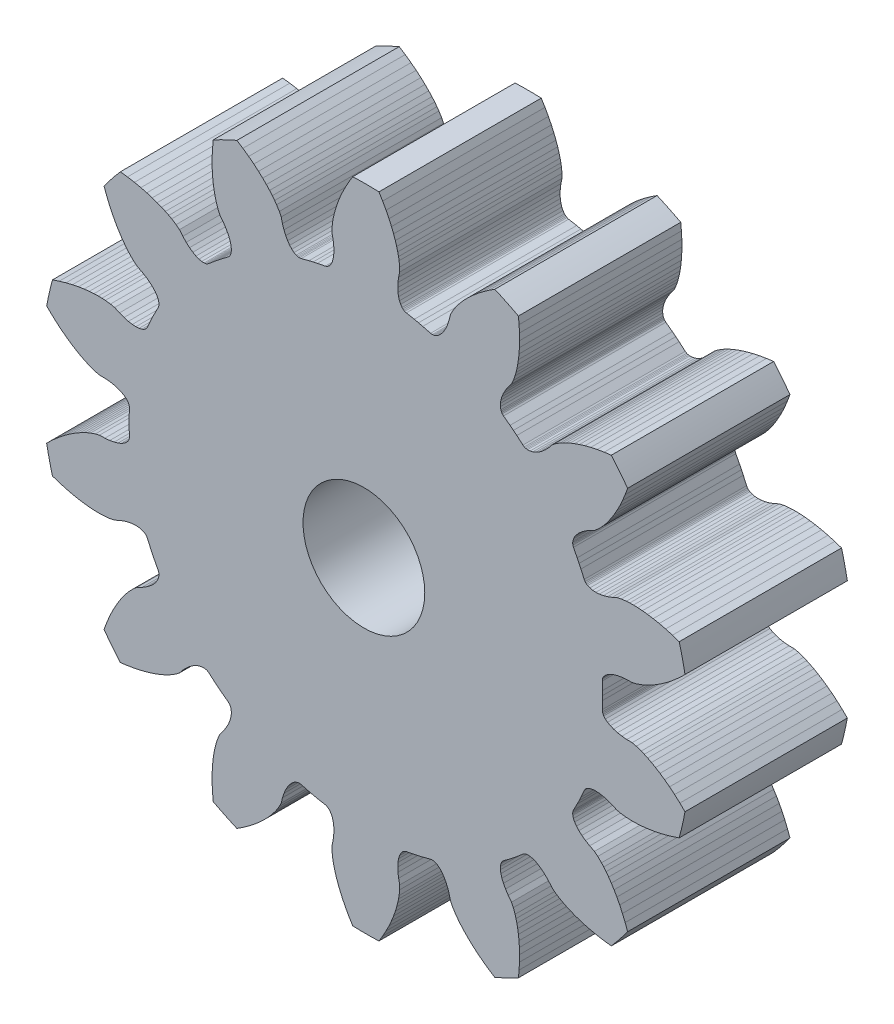
from build123d import *

# Parameters (mm, degrees)
BOSS_EXTRUDE1_DEPTH = 6
SKETCH2_R           = 2.25
CUT_EXTRUDE1_DEPTH  = 10


with BuildPart() as part:
    # Model → Boss-Extrude1 (new body)
    with BuildSketch(Plane.XY):
        with BuildLine():
            Line((0.9148214, -6.8490525), (1.0148421, -6.6078485))
            Line((1.0148421, -6.6078485), (1.1172606, -6.3873883))
            Line((1.1172606, -6.3873883), (1.2214262, -6.1857213))
            Line((1.2214262, -6.1857213), (1.3251705, -6.0039914))
            Line((1.3251705, -6.0039914), (1.4277148, -5.8407201))
            Line((1.4277148, -5.8407201), (1.5260664, -5.6977594))
            Line((1.5260664, -5.6977594), (1.620302, -5.5723419))
            Line((1.620302, -5.5723419), (1.7079994, -5.4652455))
            Line((1.7079994, -5.4652455), (1.7906353, -5.3725072))
            Line((1.7906353, -5.3725072), (1.9268131, -5.2372913))
            Line((1.9268131, -5.2372913), (2.0493671, -5.1370279))
            Line((2.0493671, -5.1370279), (2.2262191, -5.0490968))
            Line((2.2262191, -5.0490968), (2.3813178, -4.9559361))
            Line((2.3813178, -4.9559361), (2.5141973, -4.8594131))
            Line((2.5141973, -4.8594131), (2.6248996, -4.7612056))
            Line((2.6248996, -4.7612056), (2.7135427, -4.6630104))
            Line((2.7135427, -4.6630104), (2.780357, -4.5664814))
            Line((2.780357, -4.5664814), (2.8256624, -4.4732737))
            Line((2.8256624, -4.4732737), (2.849882, -4.3850037))
            Line((2.849882, -4.3850037), (2.854246, -4.3432226))
            Line((2.854246, -4.3432226), (2.8535422, -4.3032716))
            Line((2.8535422, -4.3032716), (2.8478617, -4.2653398))
            Line((2.8478617, -4.2653398), (2.826171, -4.2043957))
            Line((2.826171, -4.2043957), (2.6873019, -3.9401391))
            Line((2.6873019, -3.9401391), (2.6165224, -3.7964827))
            Line((2.6165224, -3.7964827), (2.5483377, -3.6515768))
            Line((2.5483377, -3.6515768), (2.4283169, -3.3782433))
            Line((2.4283169, -3.3782433), (2.3941928, -3.3232868))
            Line((2.3941928, -3.3232868), (2.3680783, -3.2951955))
            Line((2.3680783, -3.2951955), (2.3372822, -3.2697362))
            Line((2.3372822, -3.2697362), (2.3018955, -3.247098))
            Line((2.3018955, -3.247098), (2.2177826, -3.2109983))
            Line((2.2177826, -3.2109983), (2.1166624, -3.1883053))
            Line((2.1166624, -3.1883053), (1.9995349, -3.180358))
            Line((1.9995349, -3.180358), (1.8674948, -3.1884383))
            Line((1.8674948, -3.1884383), (1.7216913, -3.2137575))
            Line((1.7216913, -3.2137575), (1.5633775, -3.2574657))
            Line((1.5633775, -3.2574657), (1.3938392, -3.3206421))
            Line((1.3938392, -3.3206421), (1.2148265, -3.4040863))
            Line((1.2148265, -3.4040863), (1.0600262, -3.4373897))
            Line((1.0600262, -3.4373897), (0.8694046, -3.4595521))
            Line((0.8694046, -3.4595521), (0.7453763, -3.466338))
            Line((0.7453763, -3.466338), (0.6069665, -3.4681291))
            Line((0.6069665, -3.4681291), (0.4501562, -3.4636089))
            Line((0.4501562, -3.4636089), (0.2770638, -3.4513687))
            Line((0.2770638, -3.4513687), (0.0854779, -3.4297432))
            Line((0.0854779, -3.4297432), (-0.1212878, -3.397547))
            Line((-0.1212878, -3.397547), (-0.3439036, -3.3532495))
            Line((-0.3439036, -3.3532495), (-0.5801232, -3.2958689))
            Line((-0.5801232, -3.2958689), (-0.831066, -3.22368))
            Line((-0.831066, -3.22368), (-1.081843199, -3.140057591))
            ThreePointArc((-1.081843199, -3.140057591), (-1.199096477, -2.670242373), (-1.297300096, -2.196079195))
            Line((-1.297300096, -2.196079195), (-1.10764, -2.01193))
            Line((-1.10764, -2.01193), (-0.91287, -1.83801))
            Line((-0.91287, -1.83801), (-0.72494, -1.68382))
            Line((-0.72494, -1.68382), (-0.54359, -1.54732))
            Line((-0.54359, -1.54732), (-0.37127, -1.4286))
            Line((-0.37127, -1.4286), (-0.20804, -1.32599))
            Line((-0.20804, -1.32599), (-0.0574, -1.23986))
            Line((-0.0574, -1.23986), (0.08192, -1.16775))
            Line((0.08192, -1.16775), (0.2074, -1.10931))
            Line((0.2074, -1.10931), (0.32209, -1.06161))
            Line((0.32209, -1.06161), (0.50345, -0.99887))
            Line((0.50345, -0.99887), (0.65737, -0.96171))
            Line((0.65737, -0.96171), (0.85486, -0.95922))
            Line((0.85486, -0.95922), (1.03502, -0.94258))
            Line((1.03502, -0.94258), (1.19662, -0.91327))
            Line((1.19662, -0.91327), (1.33897, -0.87282))
            Line((1.33897, -0.87282), (1.46144, -0.82281))
            Line((1.46144, -0.82281), (1.56352, -0.76483))
            Line((1.56352, -0.76483), (1.64478, -0.70051))
            Line((1.64478, -0.70051), (1.7049, -0.63149))
            Line((1.7049, -0.63149), (1.72696, -0.59574))
            Line((1.72696, -0.59574), (1.74366, -0.55944))
            Line((1.74366, -0.55944), (1.755, -0.5228))
            Line((1.755, -0.5228), (1.7619, -0.45848))
            Line((1.7619, -0.45848), (1.75144, -0.16014))
            Line((1.75144, -0.16014), (1.75, 0))
            Line((1.75, 0), (1.75144, 0.16014))
            Line((1.75144, 0.16014), (1.7619, 0.45848))
            Line((1.7619, 0.45848), (1.755, 0.5228))
            Line((1.755, 0.5228), (1.74366, 0.55944))
            Line((1.74366, 0.55944), (1.72696, 0.59574))
            Line((1.72696, 0.59574), (1.7049, 0.63149))
            Line((1.7049, 0.63149), (1.64478, 0.70051))
            Line((1.64478, 0.70051), (1.56352, 0.76483))
            Line((1.56352, 0.76483), (1.46144, 0.82281))
            Line((1.46144, 0.82281), (1.33897, 0.87282))
            Line((1.33897, 0.87282), (1.19662, 0.91327))
            Line((1.19662, 0.91327), (1.03502, 0.94258))
            Line((1.03502, 0.94258), (0.85486, 0.95922))
            Line((0.85486, 0.95922), (0.65737, 0.96171))
            Line((0.65737, 0.96171), (0.50345, 0.99887))
            Line((0.50345, 0.99887), (0.32209, 1.06161))
            Line((0.32209, 1.06161), (0.2074, 1.10931))
            Line((0.2074, 1.10931), (0.08192, 1.16775))
            Line((0.08192, 1.16775), (-0.0574, 1.23986))
            Line((-0.0574, 1.23986), (-0.20804, 1.32599))
            Line((-0.20804, 1.32599), (-0.37127, 1.4286))
            Line((-0.37127, 1.4286), (-0.54359, 1.54732))
            Line((-0.54359, 1.54732), (-0.72494, 1.68382))
            Line((-0.72494, 1.68382), (-0.91287, 1.83801))
            Line((-0.91287, 1.83801), (-1.10764, 2.01193))
            Line((-1.10764, 2.01193), (-1.297300096, 2.196079295))
            ThreePointArc((-1.297300096, 2.196079295), (-1.199096477, 2.670242473), (-1.081843199, 3.140057691))
            Line((-1.081843199, 3.140057691), (-0.831066, 3.22368))
            Line((-0.831066, 3.22368), (-0.5801232, 3.2958689))
            Line((-0.5801232, 3.2958689), (-0.3439036, 3.3532495))
            Line((-0.3439036, 3.3532495), (-0.1212878, 3.397547))
            Line((-0.1212878, 3.397547), (0.0854779, 3.4297432))
            Line((0.0854779, 3.4297432), (0.2770638, 3.4513687))
            Line((0.2770638, 3.4513687), (0.4501562, 3.4636089))
            Line((0.4501562, 3.4636089), (0.6069665, 3.4681291))
            Line((0.6069665, 3.4681291), (0.7453763, 3.466338))
            Line((0.7453763, 3.466338), (0.8694046, 3.4595521))
            Line((0.8694046, 3.4595521), (1.0600262, 3.4373897))
            Line((1.0600262, 3.4373897), (1.2148265, 3.4040863))
            Line((1.2148265, 3.4040863), (1.3938392, 3.3206421))
            Line((1.3938392, 3.3206421), (1.5633775, 3.2574657))
            Line((1.5633775, 3.2574657), (1.7216913, 3.2137575))
            Line((1.7216913, 3.2137575), (1.8674948, 3.1884383))
            Line((1.8674948, 3.1884383), (1.9995349, 3.180358))
            Line((1.9995349, 3.180358), (2.1166624, 3.1883053))
            Line((2.1166624, 3.1883053), (2.2177826, 3.2109983))
            Line((2.2177826, 3.2109983), (2.3018955, 3.247098))
            Line((2.3018955, 3.247098), (2.3372822, 3.2697362))
            Line((2.3372822, 3.2697362), (2.3680783, 3.2951955))
            Line((2.3680783, 3.2951955), (2.3941928, 3.3232868))
            Line((2.3941928, 3.3232868), (2.4283169, 3.3782433))
            Line((2.4283169, 3.3782433), (2.5483377, 3.6515768))
            Line((2.5483377, 3.6515768), (2.6165224, 3.7964827))
            Line((2.6165224, 3.7964827), (2.6873019, 3.9401391))
            Line((2.6873019, 3.9401391), (2.826171, 4.2043957))
            Line((2.826171, 4.2043957), (2.8478617, 4.2653398))
            Line((2.8478617, 4.2653398), (2.8535422, 4.3032716))
            Line((2.8535422, 4.3032716), (2.854246, 4.3432226))
            Line((2.854246, 4.3432226), (2.849882, 4.3850037))
            Line((2.849882, 4.3850037), (2.8256624, 4.4732737))
            Line((2.8256624, 4.4732737), (2.780357, 4.5664814))
            Line((2.780357, 4.5664814), (2.7135427, 4.6630104))
            Line((2.7135427, 4.6630104), (2.6248996, 4.7612056))
            Line((2.6248996, 4.7612056), (2.5141973, 4.8594131))
            Line((2.5141973, 4.8594131), (2.3813178, 4.9559361))
            Line((2.3813178, 4.9559361), (2.2262191, 5.0490968))
            Line((2.2262191, 5.0490968), (2.0493671, 5.1370279))
            Line((2.0493671, 5.1370279), (1.9268131, 5.2372913))
            Line((1.9268131, 5.2372913), (1.7906353, 5.3725072))
            Line((1.7906353, 5.3725072), (1.7079994, 5.4652455))
            Line((1.7079994, 5.4652455), (1.620302, 5.5723419))
            Line((1.620302, 5.5723419), (1.5260664, 5.6977594))
            Line((1.5260664, 5.6977594), (1.4277148, 5.8407201))
            Line((1.4277148, 5.8407201), (1.3251705, 6.0039914))
            Line((1.3251705, 6.0039914), (1.2214262, 6.1857213))
            Line((1.2214262, 6.1857213), (1.1172606, 6.3873883))
            Line((1.1172606, 6.3873883), (1.0148421, 6.6078485))
            Line((1.0148421, 6.6078485), (0.9148214, 6.8490525))
            Line((0.9148214, 6.8490525), (0.82384289, 7.097255718))
            ThreePointArc((0.82384289, 7.097255718), (1.118052973, 7.481853024), (1.427539695, 7.854267617))
            Line((1.427539695, 7.854267617), (1.6897646, 7.8208006))
            Line((1.6897646, 7.8208006), (1.9471779, 7.7769606))
            Line((1.9471779, 7.7769606), (2.1849009, 7.7261669))
            Line((2.1849009, 7.7261669), (2.4046908, 7.6694881))
            Line((2.4046908, 7.6694881), (2.6049496, 7.6087836))
            Line((2.6049496, 7.6087836), (2.7869455, 7.5451415))
            Line((2.7869455, 7.5451415), (2.9482072, 7.4810676))
            Line((2.9482072, 7.4810676), (3.0914497, 7.4171027))
            Line((3.0914497, 7.4171027), (3.2153754, 7.3554352))
            Line((3.2153754, 7.3554352), (3.3241768, 7.2955075))
            Line((3.3241768, 7.2955075), (3.486305, 7.1928322))
            Line((3.486305, 7.1928322), (3.6113254, 7.0956616))
            Line((3.6113254, 7.0956616), (3.7364052, 6.9428102))
            Line((3.7364052, 6.9428102), (3.8617428, 6.8123303))
            Line((3.8617428, 6.8123303), (3.9854142, 6.7042608))
            Line((3.9854142, 6.7042608), (4.1057931, 6.6181873))
            Line((4.1057931, 6.6181873), (4.2212513, 6.5536171))
            Line((4.2212513, 6.5536171), (4.3302277, 6.5099577))
            Line((4.3302277, 6.5099577), (4.4311799, 6.4865289))
            Line((4.4311799, 6.4865289), (4.5226261, 6.4825585))
            Line((4.5226261, 6.4825585), (4.5643307, 6.4876011))
            Line((4.5643307, 6.4876011), (4.6031235, 6.4971771))
            Line((4.6031235, 6.4971771), (4.6388402, 6.5111558))
            Line((4.6388402, 6.5111558), (4.6934297, 6.5458641))
            Line((4.6934297, 6.5458641), (4.9201596, 6.740054))
            Line((4.9201596, 6.740054), (5.0444642, 6.8410255))
            Line((5.0444642, 6.8410255), (5.1705646, 6.9397453))
            Line((5.1705646, 6.9397453), (5.4103379, 7.1175793))
            Line((5.4103379, 7.1175793), (5.4563232, 7.1630768))
            Line((5.4563232, 7.1630768), (5.4778991, 7.1947874))
            Line((5.4778991, 7.1947874), (5.4958673, 7.2304767))
            Line((5.4958673, 7.2304767), (5.5100636, 7.2700136))
            Line((5.5100636, 7.2700136), (5.5265414, 7.3600506))
            Line((5.5265414, 7.3600506), (5.526164, 7.4636851))
            Line((5.526164, 7.4636851), (5.5078488, 7.5796444))
            Line((5.5078488, 7.5796444), (5.4705894, 7.706576))
            Line((5.4705894, 7.706576), (5.4134607, 7.8430899))
            Line((5.4134607, 7.8430899), (5.3356202, 7.9877084))
            Line((5.3356202, 7.9877084), (5.236302, 8.138938))
            Line((5.236302, 8.138938), (5.1151157, 8.2948944))
            Line((5.1151157, 8.2948944), (5.048201, 8.4384028))
            Line((5.048201, 8.4384028), (4.984177, 8.6193135))
            Line((4.984177, 8.6193135), (4.9499623, 8.7387222))
            Line((4.9499623, 8.7387222), (4.9174171, 8.8732631))
            Line((4.9174171, 8.8732631), (4.8869303, 9.0271478))
            Line((4.8869303, 9.0271478), (4.860347, 9.198624))
            Line((4.860347, 9.198624), (4.8387985, 9.3902187))
            Line((4.8387985, 9.3902187), (4.8241777, 9.5989646))
            Line((4.8241777, 9.5989646), (4.8178279, 9.8258561))
            Line((4.8178279, 9.8258561), (4.821206, 10.0689216))
            Line((4.821206, 10.0689216), (4.8357451, 10.3296362))
            Line((4.8357451, 10.3296362), (4.861467593, 10.592733706))
            ThreePointArc((4.861467593, 10.592733706), (5.293412243, 10.811590921), (5.733834787, 11.012843604))
            Line((5.733834787, 11.012843604), (5.9555704, 10.8689157))
            Line((5.9555704, 10.8689157), (6.1684703, 10.7177298))
            Line((6.1684703, 10.7177298), (6.3606128, 10.5688221))
            Line((6.3606128, 10.5688221), (6.5340446, 10.4223931))
            Line((6.5340446, 10.4223931), (6.6881328, 10.2808112))
            Line((6.6881328, 10.2808112), (6.8244923, 10.1445065))
            Line((6.8244923, 10.1445065), (6.9419834, 10.0168091))
            Line((6.9419834, 10.0168091), (7.043287, 9.8970282))
            Line((7.043287, 9.8970282), (7.1281838, 9.7876983))
            Line((7.1281838, 9.7876983), (7.2002087, 9.6864981))
            Line((7.2002087, 9.6864981), (7.3017321, 9.5236461))
            Line((7.3017321, 9.5236461), (7.3722109, 9.3818541))
            Line((7.3722109, 9.3818541), (7.4185841, 9.1898697))
            Line((7.4185841, 9.1898697), (7.4748963, 9.0179294))
            Line((7.4748963, 9.0179294), (7.5394308, 8.8669031))
            Line((7.5394308, 8.8669031), (7.6105425, 8.7371231))
            Line((7.6105425, 8.7371231), (7.6865508, 8.628852))
            Line((7.6865508, 8.628852), (7.765792, 8.5422331))
            Line((7.765792, 8.5422331), (7.8465814, 8.477323))
            Line((7.8465814, 8.477323), (7.9272489, 8.4340687))
            Line((7.9272489, 8.4340687), (7.9670114, 8.4205169))
            Line((7.9670114, 8.4205169), (8.0061174, 8.4123132))
            Line((8.0061174, 8.4123132), (8.0443621, 8.4094106))
            Line((8.0443621, 8.4094106), (8.1086049, 8.4169962))
            Line((8.1086049, 8.4169962), (8.3971373, 8.4935808))
            Line((8.3971373, 8.4935808), (8.5529418, 8.5306192))
            Line((8.5529418, 8.5306192), (8.7093872, 8.5648498))
            Line((8.7093872, 8.5648498), (9.0025748, 8.621039))
            Line((9.0025748, 8.621039), (9.0637467, 8.6420785))
            Line((9.0637467, 8.6420785), (9.0969447, 8.6612874))
            Line((9.0969447, 8.6612874), (9.1286185, 8.6856462))
            Line((9.1286185, 8.6856462), (9.1585634, 8.7151082))
            Line((9.1585634, 8.7151082), (9.2124749, 8.7890793))
            Line((9.2124749, 8.7890793), (9.2571002, 8.8826145))
            Line((9.2571002, 8.8826145), (9.2909116, 8.9950369))
            Line((9.2909116, 8.9950369), (9.3124156, 9.1255646))
            Line((9.3124156, 9.1255646), (9.3201756, 9.2733465))
            Line((9.3201756, 9.2733465), (9.3127914, 9.437417))
            Line((9.3127914, 9.437417), (9.2889248, 9.6167627))
            Line((9.2889248, 9.6167627), (9.2474067, 9.8098553))
            Line((9.2474067, 9.8098553), (9.2493846, 9.9681851))
            Line((9.2493846, 9.9681851), (9.2701952, 10.158959))
            Line((9.2701952, 10.158959), (9.2911783, 10.2813877))
            Line((9.2911783, 10.2813877), (9.3202312, 10.4167258))
            Line((9.3202312, 10.4167258), (9.3595316, 10.5685987))
            Line((9.3595316, 10.5685987), (9.4099816, 10.7346276))
            Line((9.4099816, 10.7346276), (9.4736969, 10.916598))
            Line((9.4736969, 10.916598), (9.5510955, 11.1110152))
            Line((9.5510955, 11.1110152), (9.643819, 11.3181925))
            Line((9.643819, 11.3181925), (9.7523248, 11.5357212))
            Line((9.7523248, 11.5357212), (9.8785438, 11.7643088))
            Line((9.8785438, 11.7643088), (10.0158727, 11.990190821))
            ThreePointArc((10.0158727, 11.990190821), (10.5, 11.9999606), (10.9841273, 11.990190821))
            Line((10.9841273, 11.990190821), (11.1214562, 11.7643088))
            Line((11.1214562, 11.7643088), (11.2476752, 11.5357212))
            Line((11.2476752, 11.5357212), (11.356181, 11.3181925))
            Line((11.356181, 11.3181925), (11.4489045, 11.1110152))
            Line((11.4489045, 11.1110152), (11.5263031, 10.916598))
            Line((11.5263031, 10.916598), (11.5900184, 10.7346276))
            Line((11.5900184, 10.7346276), (11.6404684, 10.5685987))
            Line((11.6404684, 10.5685987), (11.6797688, 10.4167258))
            Line((11.6797688, 10.4167258), (11.7088217, 10.2813877))
            Line((11.7088217, 10.2813877), (11.7298048, 10.158959))
            Line((11.7298048, 10.158959), (11.7506154, 9.9681851))
            Line((11.7506154, 9.9681851), (11.7525933, 9.8098553))
            Line((11.7525933, 9.8098553), (11.7110752, 9.6167627))
            Line((11.7110752, 9.6167627), (11.6872086, 9.437417))
            Line((11.6872086, 9.437417), (11.6798244, 9.2733465))
            Line((11.6798244, 9.2733465), (11.6875844, 9.1255646))
            Line((11.6875844, 9.1255646), (11.7090884, 8.9950369))
            Line((11.7090884, 8.9950369), (11.7428998, 8.8826145))
            Line((11.7428998, 8.8826145), (11.7875251, 8.7890793))
            Line((11.7875251, 8.7890793), (11.8414366, 8.7151082))
            Line((11.8414366, 8.7151082), (11.8713815, 8.6856462))
            Line((11.8713815, 8.6856462), (11.9030553, 8.6612874))
            Line((11.9030553, 8.6612874), (11.9362533, 8.6420785))
            Line((11.9362533, 8.6420785), (11.9974252, 8.621039))
            Line((11.9974252, 8.621039), (12.2906128, 8.5648498))
            Line((12.2906128, 8.5648498), (12.4470582, 8.5306192))
            Line((12.4470582, 8.5306192), (12.6028627, 8.4935808))
            Line((12.6028627, 8.4935808), (12.8913951, 8.4169962))
            Line((12.8913951, 8.4169962), (12.9556379, 8.4094106))
            Line((12.9556379, 8.4094106), (12.9938826, 8.4123132))
            Line((12.9938826, 8.4123132), (13.0329886, 8.4205169))
            Line((13.0329886, 8.4205169), (13.0727511, 8.4340687))
            Line((13.0727511, 8.4340687), (13.1534186, 8.477323))
            Line((13.1534186, 8.477323), (13.234208, 8.5422331))
            Line((13.234208, 8.5422331), (13.3134492, 8.628852))
            Line((13.3134492, 8.628852), (13.3894575, 8.7371231))
            Line((13.3894575, 8.7371231), (13.4605692, 8.8669031))
            Line((13.4605692, 8.8669031), (13.5251037, 9.0179294))
            Line((13.5251037, 9.0179294), (13.5814159, 9.1898697))
            Line((13.5814159, 9.1898697), (13.6277891, 9.3818541))
            Line((13.6277891, 9.3818541), (13.6982679, 9.5236461))
            Line((13.6982679, 9.5236461), (13.7997913, 9.6864981))
            Line((13.7997913, 9.6864981), (13.8718162, 9.7876983))
            Line((13.8718162, 9.7876983), (13.956713, 9.8970282))
            Line((13.956713, 9.8970282), (14.0580166, 10.0168091))
            Line((14.0580166, 10.0168091), (14.1755077, 10.1445065))
            Line((14.1755077, 10.1445065), (14.3118672, 10.2808112))
            Line((14.3118672, 10.2808112), (14.4659554, 10.4223931))
            Line((14.4659554, 10.4223931), (14.6393872, 10.5688221))
            Line((14.6393872, 10.5688221), (14.8315297, 10.7177298))
            Line((14.8315297, 10.7177298), (15.0444296, 10.8689157))
            Line((15.0444296, 10.8689157), (15.266165213, 11.012843604))
            ThreePointArc((15.266165213, 11.012843604), (15.706587757, 10.811590921), (16.138532407, 10.592733706))
            Line((16.138532407, 10.592733706), (16.1642549, 10.3296362))
            Line((16.1642549, 10.3296362), (16.178794, 10.0689216))
            Line((16.178794, 10.0689216), (16.1821721, 9.8258561))
            Line((16.1821721, 9.8258561), (16.1758223, 9.5989646))
            Line((16.1758223, 9.5989646), (16.1612015, 9.3902187))
            Line((16.1612015, 9.3902187), (16.139653, 9.198624))
            Line((16.139653, 9.198624), (16.1130697, 9.0271478))
            Line((16.1130697, 9.0271478), (16.0825829, 8.8732631))
            Line((16.0825829, 8.8732631), (16.0500377, 8.7387222))
            Line((16.0500377, 8.7387222), (16.015823, 8.6193135))
            Line((16.015823, 8.6193135), (15.951799, 8.4384028))
            Line((15.951799, 8.4384028), (15.8848843, 8.2948944))
            Line((15.8848843, 8.2948944), (15.763698, 8.138938))
            Line((15.763698, 8.138938), (15.6643798, 7.9877084))
            Line((15.6643798, 7.9877084), (15.5865393, 7.8430899))
            Line((15.5865393, 7.8430899), (15.5294106, 7.706576))
            Line((15.5294106, 7.706576), (15.4921512, 7.5796444))
            Line((15.4921512, 7.5796444), (15.473836, 7.4636851))
            Line((15.473836, 7.4636851), (15.4734586, 7.3600506))
            Line((15.4734586, 7.3600506), (15.4899364, 7.2700136))
            Line((15.4899364, 7.2700136), (15.5041327, 7.2304767))
            Line((15.5041327, 7.2304767), (15.5221009, 7.1947874))
            Line((15.5221009, 7.1947874), (15.5436768, 7.1630768))
            Line((15.5436768, 7.1630768), (15.5896621, 7.1175793))
            Line((15.5896621, 7.1175793), (15.8294354, 6.9397453))
            Line((15.8294354, 6.9397453), (15.9555358, 6.8410255))
            Line((15.9555358, 6.8410255), (16.0798404, 6.740054))
            Line((16.0798404, 6.740054), (16.3065703, 6.5458641))
            Line((16.3065703, 6.5458641), (16.3611598, 6.5111558))
            Line((16.3611598, 6.5111558), (16.3968765, 6.4971771))
            Line((16.3968765, 6.4971771), (16.4356693, 6.4876011))
            Line((16.4356693, 6.4876011), (16.4773739, 6.4825585))
            Line((16.4773739, 6.4825585), (16.5688201, 6.4865289))
            Line((16.5688201, 6.4865289), (16.6697723, 6.5099577))
            Line((16.6697723, 6.5099577), (16.7787487, 6.5536171))
            Line((16.7787487, 6.5536171), (16.8942069, 6.6181873))
            Line((16.8942069, 6.6181873), (17.0145858, 6.7042608))
            Line((17.0145858, 6.7042608), (17.1382572, 6.8123303))
            Line((17.1382572, 6.8123303), (17.2635948, 6.9428102))
            Line((17.2635948, 6.9428102), (17.3886746, 7.0956616))
            Line((17.3886746, 7.0956616), (17.513695, 7.1928322))
            Line((17.513695, 7.1928322), (17.6758232, 7.2955075))
            Line((17.6758232, 7.2955075), (17.7846246, 7.3554352))
            Line((17.7846246, 7.3554352), (17.9085503, 7.4171027))
            Line((17.9085503, 7.4171027), (18.0517928, 7.4810676))
            Line((18.0517928, 7.4810676), (18.2130545, 7.5451415))
            Line((18.2130545, 7.5451415), (18.3950504, 7.6087836))
            Line((18.3950504, 7.6087836), (18.5953092, 7.6694881))
            Line((18.5953092, 7.6694881), (18.8150991, 7.7261669))
            Line((18.8150991, 7.7261669), (19.0528221, 7.7769606))
            Line((19.0528221, 7.7769606), (19.3102354, 7.8208006))
            Line((19.3102354, 7.8208006), (19.57246016, 7.854267554))
            ThreePointArc((19.57246016, 7.854267554), (19.881946873, 7.481852967), (20.176156947, 7.097255668))
            Line((20.176156947, 7.097255668), (20.0851786, 6.8490525))
            Line((20.0851786, 6.8490525), (19.9851579, 6.6078485))
            Line((19.9851579, 6.6078485), (19.8827394, 6.3873883))
            Line((19.8827394, 6.3873883), (19.7785738, 6.1857213))
            Line((19.7785738, 6.1857213), (19.6748295, 6.0039914))
            Line((19.6748295, 6.0039914), (19.5722852, 5.8407201))
            Line((19.5722852, 5.8407201), (19.4739336, 5.6977594))
            Line((19.4739336, 5.6977594), (19.379698, 5.5723419))
            Line((19.379698, 5.5723419), (19.2920006, 5.4652455))
            Line((19.2920006, 5.4652455), (19.2093647, 5.3725072))
            Line((19.2093647, 5.3725072), (19.0731869, 5.2372913))
            Line((19.0731869, 5.2372913), (18.9506329, 5.1370279))
            Line((18.9506329, 5.1370279), (18.7737809, 5.0490968))
            Line((18.7737809, 5.0490968), (18.6186822, 4.9559361))
            Line((18.6186822, 4.9559361), (18.4858027, 4.8594131))
            Line((18.4858027, 4.8594131), (18.3751004, 4.7612056))
            Line((18.3751004, 4.7612056), (18.2864573, 4.6630104))
            Line((18.2864573, 4.6630104), (18.219643, 4.5664814))
            Line((18.219643, 4.5664814), (18.1743376, 4.4732737))
            Line((18.1743376, 4.4732737), (18.150118, 4.3850037))
            Line((18.150118, 4.3850037), (18.145754, 4.3432226))
            Line((18.145754, 4.3432226), (18.1464578, 4.3032716))
            Line((18.1464578, 4.3032716), (18.1521383, 4.2653398))
            Line((18.1521383, 4.2653398), (18.173829, 4.2043957))
            Line((18.173829, 4.2043957), (18.3126981, 3.9401391))
            Line((18.3126981, 3.9401391), (18.3834776, 3.7964827))
            Line((18.3834776, 3.7964827), (18.4516623, 3.6515768))
            Line((18.4516623, 3.6515768), (18.5716831, 3.3782433))
            Line((18.5716831, 3.3782433), (18.6058072, 3.3232868))
            Line((18.6058072, 3.3232868), (18.6319217, 3.2951955))
            Line((18.6319217, 3.2951955), (18.6627178, 3.2697362))
            Line((18.6627178, 3.2697362), (18.6981045, 3.247098))
            Line((18.6981045, 3.247098), (18.7822174, 3.2109983))
            Line((18.7822174, 3.2109983), (18.8833376, 3.1883053))
            Line((18.8833376, 3.1883053), (19.0004651, 3.180358))
            Line((19.0004651, 3.180358), (19.1325052, 3.1884383))
            Line((19.1325052, 3.1884383), (19.2783087, 3.2137575))
            Line((19.2783087, 3.2137575), (19.4366225, 3.2574657))
            Line((19.4366225, 3.2574657), (19.6061608, 3.3206421))
            Line((19.6061608, 3.3206421), (19.7851735, 3.4040863))
            Line((19.7851735, 3.4040863), (19.9399738, 3.4373897))
            Line((19.9399738, 3.4373897), (20.1305954, 3.4595521))
            Line((20.1305954, 3.4595521), (20.2546237, 3.466338))
            Line((20.2546237, 3.466338), (20.3930335, 3.4681291))
            Line((20.3930335, 3.4681291), (20.5498438, 3.4636089))
            Line((20.5498438, 3.4636089), (20.7229362, 3.4513687))
            Line((20.7229362, 3.4513687), (20.9145221, 3.4297432))
            Line((20.9145221, 3.4297432), (21.1212878, 3.397547))
            Line((21.1212878, 3.397547), (21.3439036, 3.3532495))
            Line((21.3439036, 3.3532495), (21.5801232, 3.2958689))
            Line((21.5801232, 3.2958689), (21.831066, 3.22368))
            Line((21.831066, 3.22368), (22.081843199, 3.140057591))
            ThreePointArc((22.081843199, 3.140057591), (22.199096477, 2.670242373), (22.297300096, 2.196079195))
            Line((22.297300096, 2.196079195), (22.10764, 2.01193))
            Line((22.10764, 2.01193), (21.91287, 1.83801))
            Line((21.91287, 1.83801), (21.72494, 1.68382))
            Line((21.72494, 1.68382), (21.54359, 1.54732))
            Line((21.54359, 1.54732), (21.37127, 1.4286))
            Line((21.37127, 1.4286), (21.20804, 1.32599))
            Line((21.20804, 1.32599), (21.0574, 1.23986))
            Line((21.0574, 1.23986), (20.91808, 1.16775))
            Line((20.91808, 1.16775), (20.7926, 1.10931))
            Line((20.7926, 1.10931), (20.67791, 1.06161))
            Line((20.67791, 1.06161), (20.49655, 0.99887))
            Line((20.49655, 0.99887), (20.34263, 0.96171))
            Line((20.34263, 0.96171), (20.14514, 0.95922))
            Line((20.14514, 0.95922), (19.96498, 0.94258))
            Line((19.96498, 0.94258), (19.80338, 0.91327))
            Line((19.80338, 0.91327), (19.66103, 0.87282))
            Line((19.66103, 0.87282), (19.53856, 0.82281))
            Line((19.53856, 0.82281), (19.43648, 0.76483))
            Line((19.43648, 0.76483), (19.35522, 0.70051))
            Line((19.35522, 0.70051), (19.2951, 0.63149))
            Line((19.2951, 0.63149), (19.27304, 0.59574))
            Line((19.27304, 0.59574), (19.25634, 0.55944))
            Line((19.25634, 0.55944), (19.245, 0.5228))
            Line((19.245, 0.5228), (19.2381, 0.45848))
            Line((19.2381, 0.45848), (19.24856, 0.16014))
            Line((19.24856, 0.16014), (19.25, 0))
            Line((19.25, 0), (19.24856, -0.16014))
            Line((19.24856, -0.16014), (19.2381, -0.45848))
            Line((19.2381, -0.45848), (19.245, -0.5228))
            Line((19.245, -0.5228), (19.25634, -0.55944))
            Line((19.25634, -0.55944), (19.27304, -0.59574))
            Line((19.27304, -0.59574), (19.2951, -0.63149))
            Line((19.2951, -0.63149), (19.35522, -0.70051))
            Line((19.35522, -0.70051), (19.43648, -0.76483))
            Line((19.43648, -0.76483), (19.53856, -0.82281))
            Line((19.53856, -0.82281), (19.66103, -0.87282))
            Line((19.66103, -0.87282), (19.80338, -0.91327))
            Line((19.80338, -0.91327), (19.96498, -0.94258))
            Line((19.96498, -0.94258), (20.14514, -0.95922))
            Line((20.14514, -0.95922), (20.34263, -0.96171))
            Line((20.34263, -0.96171), (20.49655, -0.99887))
            Line((20.49655, -0.99887), (20.67791, -1.06161))
            Line((20.67791, -1.06161), (20.7926, -1.10931))
            Line((20.7926, -1.10931), (20.91808, -1.16775))
            Line((20.91808, -1.16775), (21.0574, -1.23986))
            Line((21.0574, -1.23986), (21.20804, -1.32599))
            Line((21.20804, -1.32599), (21.37127, -1.4286))
            Line((21.37127, -1.4286), (21.54359, -1.54732))
            Line((21.54359, -1.54732), (21.72494, -1.68382))
            Line((21.72494, -1.68382), (21.91287, -1.83801))
            Line((21.91287, -1.83801), (22.10764, -2.01193))
            Line((22.10764, -2.01193), (22.297300096, -2.196079295))
            ThreePointArc((22.297300096, -2.196079295), (22.199096477, -2.670242473), (22.081843199, -3.140057691))
            Line((22.081843199, -3.140057691), (21.831066, -3.22368))
            Line((21.831066, -3.22368), (21.5801232, -3.2958689))
            Line((21.5801232, -3.2958689), (21.3439036, -3.3532495))
            Line((21.3439036, -3.3532495), (21.1212878, -3.397547))
            Line((21.1212878, -3.397547), (20.9145221, -3.4297432))
            Line((20.9145221, -3.4297432), (20.7229362, -3.4513687))
            Line((20.7229362, -3.4513687), (20.5498438, -3.4636089))
            Line((20.5498438, -3.4636089), (20.3930335, -3.4681291))
            Line((20.3930335, -3.4681291), (20.2546237, -3.466338))
            Line((20.2546237, -3.466338), (20.1305954, -3.4595521))
            Line((20.1305954, -3.4595521), (19.9399738, -3.4373897))
            Line((19.9399738, -3.4373897), (19.7851735, -3.4040863))
            Line((19.7851735, -3.4040863), (19.6061608, -3.3206421))
            Line((19.6061608, -3.3206421), (19.4366225, -3.2574657))
            Line((19.4366225, -3.2574657), (19.2783087, -3.2137575))
            Line((19.2783087, -3.2137575), (19.1325052, -3.1884383))
            Line((19.1325052, -3.1884383), (19.0004651, -3.180358))
            Line((19.0004651, -3.180358), (18.8833376, -3.1883053))
            Line((18.8833376, -3.1883053), (18.7822174, -3.2109983))
            Line((18.7822174, -3.2109983), (18.6981045, -3.247098))
            Line((18.6981045, -3.247098), (18.6627178, -3.2697362))
            Line((18.6627178, -3.2697362), (18.6319217, -3.2951955))
            Line((18.6319217, -3.2951955), (18.6058072, -3.3232868))
            Line((18.6058072, -3.3232868), (18.5716831, -3.3782433))
            Line((18.5716831, -3.3782433), (18.4516623, -3.6515768))
            Line((18.4516623, -3.6515768), (18.3834776, -3.7964827))
            Line((18.3834776, -3.7964827), (18.3126981, -3.9401391))
            Line((18.3126981, -3.9401391), (18.173829, -4.2043957))
            Line((18.173829, -4.2043957), (18.1521383, -4.2653398))
            Line((18.1521383, -4.2653398), (18.1464578, -4.3032716))
            Line((18.1464578, -4.3032716), (18.145754, -4.3432226))
            Line((18.145754, -4.3432226), (18.150118, -4.3850037))
            Line((18.150118, -4.3850037), (18.1743376, -4.4732737))
            Line((18.1743376, -4.4732737), (18.219643, -4.5664814))
            Line((18.219643, -4.5664814), (18.2864573, -4.6630104))
            Line((18.2864573, -4.6630104), (18.3751004, -4.7612056))
            Line((18.3751004, -4.7612056), (18.4858027, -4.8594131))
            Line((18.4858027, -4.8594131), (18.6186822, -4.9559361))
            Line((18.6186822, -4.9559361), (18.7737809, -5.0490968))
            Line((18.7737809, -5.0490968), (18.9506329, -5.1370279))
            Line((18.9506329, -5.1370279), (19.0731869, -5.2372913))
            Line((19.0731869, -5.2372913), (19.2093647, -5.3725072))
            Line((19.2093647, -5.3725072), (19.2920006, -5.4652455))
            Line((19.2920006, -5.4652455), (19.379698, -5.5723419))
            Line((19.379698, -5.5723419), (19.4739336, -5.6977594))
            Line((19.4739336, -5.6977594), (19.5722852, -5.8407201))
            Line((19.5722852, -5.8407201), (19.6748295, -6.0039914))
            Line((19.6748295, -6.0039914), (19.7785738, -6.1857213))
            Line((19.7785738, -6.1857213), (19.8827394, -6.3873883))
            Line((19.8827394, -6.3873883), (19.9851579, -6.6078485))
            Line((19.9851579, -6.6078485), (20.0851786, -6.8490525))
            Line((20.0851786, -6.8490525), (20.17615711, -7.097255718))
            ThreePointArc((20.17615711, -7.097255718), (19.881947027, -7.481853024), (19.572460305, -7.854267617))
            Line((19.572460305, -7.854267617), (19.3102354, -7.8208006))
            Line((19.3102354, -7.8208006), (19.0528221, -7.7769606))
            Line((19.0528221, -7.7769606), (18.8150991, -7.7261669))
            Line((18.8150991, -7.7261669), (18.5953092, -7.6694881))
            Line((18.5953092, -7.6694881), (18.3950504, -7.6087836))
            Line((18.3950504, -7.6087836), (18.2130545, -7.5451415))
            Line((18.2130545, -7.5451415), (18.0517928, -7.4810676))
            Line((18.0517928, -7.4810676), (17.9085503, -7.4171027))
            Line((17.9085503, -7.4171027), (17.7846246, -7.3554352))
            Line((17.7846246, -7.3554352), (17.6758232, -7.2955075))
            Line((17.6758232, -7.2955075), (17.513695, -7.1928322))
            Line((17.513695, -7.1928322), (17.3886746, -7.0956616))
            Line((17.3886746, -7.0956616), (17.2635948, -6.9428102))
            Line((17.2635948, -6.9428102), (17.1382572, -6.8123303))
            Line((17.1382572, -6.8123303), (17.0145858, -6.7042608))
            Line((17.0145858, -6.7042608), (16.8942069, -6.6181873))
            Line((16.8942069, -6.6181873), (16.7787487, -6.5536171))
            Line((16.7787487, -6.5536171), (16.6697723, -6.5099577))
            Line((16.6697723, -6.5099577), (16.5688201, -6.4865289))
            Line((16.5688201, -6.4865289), (16.4773739, -6.4825585))
            Line((16.4773739, -6.4825585), (16.4356693, -6.4876011))
            Line((16.4356693, -6.4876011), (16.3968765, -6.4971771))
            Line((16.3968765, -6.4971771), (16.3611598, -6.5111558))
            Line((16.3611598, -6.5111558), (16.3065703, -6.5458641))
            Line((16.3065703, -6.5458641), (16.0798404, -6.740054))
            Line((16.0798404, -6.740054), (15.9555358, -6.8410255))
            Line((15.9555358, -6.8410255), (15.8294354, -6.9397453))
            Line((15.8294354, -6.9397453), (15.5896621, -7.1175793))
            Line((15.5896621, -7.1175793), (15.5436768, -7.1630768))
            Line((15.5436768, -7.1630768), (15.5221009, -7.1947874))
            Line((15.5221009, -7.1947874), (15.5041327, -7.2304767))
            Line((15.5041327, -7.2304767), (15.4899364, -7.2700136))
            Line((15.4899364, -7.2700136), (15.4734586, -7.3600506))
            Line((15.4734586, -7.3600506), (15.473836, -7.4636851))
            Line((15.473836, -7.4636851), (15.4921512, -7.5796444))
            Line((15.4921512, -7.5796444), (15.5294106, -7.706576))
            Line((15.5294106, -7.706576), (15.5865393, -7.8430899))
            Line((15.5865393, -7.8430899), (15.6643798, -7.9877084))
            Line((15.6643798, -7.9877084), (15.763698, -8.138938))
            Line((15.763698, -8.138938), (15.8848843, -8.2948944))
            Line((15.8848843, -8.2948944), (15.951799, -8.4384028))
            Line((15.951799, -8.4384028), (16.015823, -8.6193135))
            Line((16.015823, -8.6193135), (16.0500377, -8.7387222))
            Line((16.0500377, -8.7387222), (16.0825829, -8.8732631))
            Line((16.0825829, -8.8732631), (16.1130697, -9.0271478))
            Line((16.1130697, -9.0271478), (16.139653, -9.198624))
            Line((16.139653, -9.198624), (16.1612015, -9.3902187))
            Line((16.1612015, -9.3902187), (16.1758223, -9.5989646))
            Line((16.1758223, -9.5989646), (16.1821721, -9.8258561))
            Line((16.1821721, -9.8258561), (16.178794, -10.0689216))
            Line((16.178794, -10.0689216), (16.1642549, -10.3296362))
            Line((16.1642549, -10.3296362), (16.138532407, -10.592733706))
            ThreePointArc((16.138532407, -10.592733706), (15.706587757, -10.811590921), (15.266165213, -11.012843604))
            Line((15.266165213, -11.012843604), (15.0444296, -10.8689157))
            Line((15.0444296, -10.8689157), (14.8315297, -10.7177298))
            Line((14.8315297, -10.7177298), (14.6393872, -10.5688221))
            Line((14.6393872, -10.5688221), (14.4659554, -10.4223931))
            Line((14.4659554, -10.4223931), (14.3118672, -10.2808112))
            Line((14.3118672, -10.2808112), (14.1755077, -10.1445065))
            Line((14.1755077, -10.1445065), (14.0580166, -10.0168091))
            Line((14.0580166, -10.0168091), (13.956713, -9.8970282))
            Line((13.956713, -9.8970282), (13.8718162, -9.7876983))
            Line((13.8718162, -9.7876983), (13.7997913, -9.6864981))
            Line((13.7997913, -9.6864981), (13.6982679, -9.5236461))
            Line((13.6982679, -9.5236461), (13.6277891, -9.3818541))
            Line((13.6277891, -9.3818541), (13.5814159, -9.1898697))
            Line((13.5814159, -9.1898697), (13.5251037, -9.0179294))
            Line((13.5251037, -9.0179294), (13.4605692, -8.8669031))
            Line((13.4605692, -8.8669031), (13.3894575, -8.7371231))
            Line((13.3894575, -8.7371231), (13.3134492, -8.628852))
            Line((13.3134492, -8.628852), (13.234208, -8.5422331))
            Line((13.234208, -8.5422331), (13.1534186, -8.477323))
            Line((13.1534186, -8.477323), (13.0727511, -8.4340687))
            Line((13.0727511, -8.4340687), (13.0329886, -8.4205169))
            Line((13.0329886, -8.4205169), (12.9938826, -8.4123132))
            Line((12.9938826, -8.4123132), (12.9556379, -8.4094106))
            Line((12.9556379, -8.4094106), (12.8913951, -8.4169962))
            Line((12.8913951, -8.4169962), (12.6028627, -8.4935808))
            Line((12.6028627, -8.4935808), (12.4470582, -8.5306192))
            Line((12.4470582, -8.5306192), (12.2906128, -8.5648498))
            Line((12.2906128, -8.5648498), (11.9974252, -8.621039))
            Line((11.9974252, -8.621039), (11.9362533, -8.6420785))
            Line((11.9362533, -8.6420785), (11.9030553, -8.6612874))
            Line((11.9030553, -8.6612874), (11.8713815, -8.6856462))
            Line((11.8713815, -8.6856462), (11.8414366, -8.7151082))
            Line((11.8414366, -8.7151082), (11.7875251, -8.7890793))
            Line((11.7875251, -8.7890793), (11.7428998, -8.8826145))
            Line((11.7428998, -8.8826145), (11.7090884, -8.9950369))
            Line((11.7090884, -8.9950369), (11.6875844, -9.1255646))
            Line((11.6875844, -9.1255646), (11.6798244, -9.2733465))
            Line((11.6798244, -9.2733465), (11.6872086, -9.437417))
            Line((11.6872086, -9.437417), (11.7110752, -9.6167627))
            Line((11.7110752, -9.6167627), (11.7525933, -9.8098553))
            Line((11.7525933, -9.8098553), (11.7506154, -9.9681851))
            Line((11.7506154, -9.9681851), (11.7298048, -10.158959))
            Line((11.7298048, -10.158959), (11.7088217, -10.2813877))
            Line((11.7088217, -10.2813877), (11.6797688, -10.4167258))
            Line((11.6797688, -10.4167258), (11.6404684, -10.5685987))
            Line((11.6404684, -10.5685987), (11.5900184, -10.7346276))
            Line((11.5900184, -10.7346276), (11.5263031, -10.916598))
            Line((11.5263031, -10.916598), (11.4489045, -11.1110152))
            Line((11.4489045, -11.1110152), (11.356181, -11.3181925))
            Line((11.356181, -11.3181925), (11.2476752, -11.5357212))
            Line((11.2476752, -11.5357212), (11.1214562, -11.7643088))
            Line((11.1214562, -11.7643088), (10.9841273, -11.990190821))
            ThreePointArc((10.9841273, -11.990190821), (10.5, -11.9999606), (10.0158727, -11.990190821))
            Line((10.0158727, -11.990190821), (9.8785438, -11.7643088))
            Line((9.8785438, -11.7643088), (9.7523248, -11.5357212))
            Line((9.7523248, -11.5357212), (9.643819, -11.3181925))
            Line((9.643819, -11.3181925), (9.5510955, -11.1110152))
            Line((9.5510955, -11.1110152), (9.4736969, -10.916598))
            Line((9.4736969, -10.916598), (9.4099816, -10.7346276))
            Line((9.4099816, -10.7346276), (9.3595316, -10.5685987))
            Line((9.3595316, -10.5685987), (9.3202312, -10.4167258))
            Line((9.3202312, -10.4167258), (9.2911783, -10.2813877))
            Line((9.2911783, -10.2813877), (9.2701952, -10.158959))
            Line((9.2701952, -10.158959), (9.2493846, -9.9681851))
            Line((9.2493846, -9.9681851), (9.2474067, -9.8098553))
            Line((9.2474067, -9.8098553), (9.2889248, -9.6167627))
            Line((9.2889248, -9.6167627), (9.3127914, -9.437417))
            Line((9.3127914, -9.437417), (9.3201756, -9.2733465))
            Line((9.3201756, -9.2733465), (9.3124156, -9.1255646))
            Line((9.3124156, -9.1255646), (9.2909116, -8.9950369))
            Line((9.2909116, -8.9950369), (9.2571002, -8.8826145))
            Line((9.2571002, -8.8826145), (9.2124749, -8.7890793))
            Line((9.2124749, -8.7890793), (9.1585634, -8.7151082))
            Line((9.1585634, -8.7151082), (9.1286185, -8.6856462))
            Line((9.1286185, -8.6856462), (9.0969447, -8.6612874))
            Line((9.0969447, -8.6612874), (9.0637467, -8.6420785))
            Line((9.0637467, -8.6420785), (9.0025748, -8.621039))
            Line((9.0025748, -8.621039), (8.7093872, -8.5648498))
            Line((8.7093872, -8.5648498), (8.5529418, -8.5306192))
            Line((8.5529418, -8.5306192), (8.3971373, -8.4935808))
            Line((8.3971373, -8.4935808), (8.1086049, -8.4169962))
            Line((8.1086049, -8.4169962), (8.0443621, -8.4094106))
            Line((8.0443621, -8.4094106), (8.0061174, -8.4123132))
            Line((8.0061174, -8.4123132), (7.9670114, -8.4205169))
            Line((7.9670114, -8.4205169), (7.9272489, -8.4340687))
            Line((7.9272489, -8.4340687), (7.8465814, -8.477323))
            Line((7.8465814, -8.477323), (7.765792, -8.5422331))
            Line((7.765792, -8.5422331), (7.6865508, -8.628852))
            Line((7.6865508, -8.628852), (7.6105425, -8.7371231))
            Line((7.6105425, -8.7371231), (7.5394308, -8.8669031))
            Line((7.5394308, -8.8669031), (7.4748963, -9.0179294))
            Line((7.4748963, -9.0179294), (7.4185841, -9.1898697))
            Line((7.4185841, -9.1898697), (7.3722109, -9.3818541))
            Line((7.3722109, -9.3818541), (7.3017321, -9.5236461))
            Line((7.3017321, -9.5236461), (7.2002087, -9.6864981))
            Line((7.2002087, -9.6864981), (7.1281838, -9.7876983))
            Line((7.1281838, -9.7876983), (7.043287, -9.8970282))
            Line((7.043287, -9.8970282), (6.9419834, -10.0168091))
            Line((6.9419834, -10.0168091), (6.8244923, -10.1445065))
            Line((6.8244923, -10.1445065), (6.6881328, -10.2808112))
            Line((6.6881328, -10.2808112), (6.5340446, -10.4223931))
            Line((6.5340446, -10.4223931), (6.3606128, -10.5688221))
            Line((6.3606128, -10.5688221), (6.1684703, -10.7177298))
            Line((6.1684703, -10.7177298), (5.9555704, -10.8689157))
            Line((5.9555704, -10.8689157), (5.733834787, -11.012843604))
            ThreePointArc((5.733834787, -11.012843604), (5.293412243, -10.811590921), (4.861467593, -10.592733706))
            Line((4.861467593, -10.592733706), (4.8357451, -10.3296362))
            Line((4.8357451, -10.3296362), (4.821206, -10.0689216))
            Line((4.821206, -10.0689216), (4.8178279, -9.8258561))
            Line((4.8178279, -9.8258561), (4.8241777, -9.5989646))
            Line((4.8241777, -9.5989646), (4.8387985, -9.3902187))
            Line((4.8387985, -9.3902187), (4.860347, -9.198624))
            Line((4.860347, -9.198624), (4.8869303, -9.0271478))
            Line((4.8869303, -9.0271478), (4.9174171, -8.8732631))
            Line((4.9174171, -8.8732631), (4.9499623, -8.7387222))
            Line((4.9499623, -8.7387222), (4.984177, -8.6193135))
            Line((4.984177, -8.6193135), (5.048201, -8.4384028))
            Line((5.048201, -8.4384028), (5.1151157, -8.2948944))
            Line((5.1151157, -8.2948944), (5.236302, -8.138938))
            Line((5.236302, -8.138938), (5.3356202, -7.9877084))
            Line((5.3356202, -7.9877084), (5.4134607, -7.8430899))
            Line((5.4134607, -7.8430899), (5.4705894, -7.706576))
            Line((5.4705894, -7.706576), (5.5078488, -7.5796444))
            Line((5.5078488, -7.5796444), (5.526164, -7.4636851))
            Line((5.526164, -7.4636851), (5.5265414, -7.3600506))
            Line((5.5265414, -7.3600506), (5.5100636, -7.2700136))
            Line((5.5100636, -7.2700136), (5.4958673, -7.2304767))
            Line((5.4958673, -7.2304767), (5.4778991, -7.1947874))
            Line((5.4778991, -7.1947874), (5.4563232, -7.1630768))
            Line((5.4563232, -7.1630768), (5.4103379, -7.1175793))
            Line((5.4103379, -7.1175793), (5.1705646, -6.9397453))
            Line((5.1705646, -6.9397453), (5.0444642, -6.8410255))
            Line((5.0444642, -6.8410255), (4.9201596, -6.740054))
            Line((4.9201596, -6.740054), (4.6934297, -6.5458641))
            Line((4.6934297, -6.5458641), (4.6388402, -6.5111558))
            Line((4.6388402, -6.5111558), (4.6031235, -6.4971771))
            Line((4.6031235, -6.4971771), (4.5643307, -6.4876011))
            Line((4.5643307, -6.4876011), (4.5226261, -6.4825585))
            Line((4.5226261, -6.4825585), (4.4311799, -6.4865289))
            Line((4.4311799, -6.4865289), (4.3302277, -6.5099577))
            Line((4.3302277, -6.5099577), (4.2212513, -6.5536171))
            Line((4.2212513, -6.5536171), (4.1057931, -6.6181873))
            Line((4.1057931, -6.6181873), (3.9854142, -6.7042608))
            Line((3.9854142, -6.7042608), (3.8617428, -6.8123303))
            Line((3.8617428, -6.8123303), (3.7364052, -6.9428102))
            Line((3.7364052, -6.9428102), (3.6113254, -7.0956616))
            Line((3.6113254, -7.0956616), (3.486305, -7.1928322))
            Line((3.486305, -7.1928322), (3.3241768, -7.2955075))
            Line((3.3241768, -7.2955075), (3.2153754, -7.3554352))
            Line((3.2153754, -7.3554352), (3.0914497, -7.4171027))
            Line((3.0914497, -7.4171027), (2.9482072, -7.4810676))
            Line((2.9482072, -7.4810676), (2.7869455, -7.5451415))
            Line((2.7869455, -7.5451415), (2.6049496, -7.6087836))
            Line((2.6049496, -7.6087836), (2.4046908, -7.6694881))
            Line((2.4046908, -7.6694881), (2.1849009, -7.7261669))
            Line((2.1849009, -7.7261669), (1.9471779, -7.7769606))
            Line((1.9471779, -7.7769606), (1.6897646, -7.8208006))
            Line((1.6897646, -7.8208006), (1.42753984, -7.854267554))
            ThreePointArc((1.42753984, -7.854267554), (1.118053127, -7.481852967), (0.823843053, -7.097255668))
            Line((0.823843053, -7.097255668), (0.9148214, -6.8490525))
        make_face()
    extrude(amount=BOSS_EXTRUDE1_DEPTH)

    # Sketch2 → Cut-Extrude1 (cut)
    with BuildSketch(Plane.XY.offset(6)):
        with Locations((10.428073997, 3.913e-05)):
            Circle(SKETCH2_R)
    extrude(amount=-CUT_EXTRUDE1_DEPTH, mode=Mode.SUBTRACT)


solid = part.part
